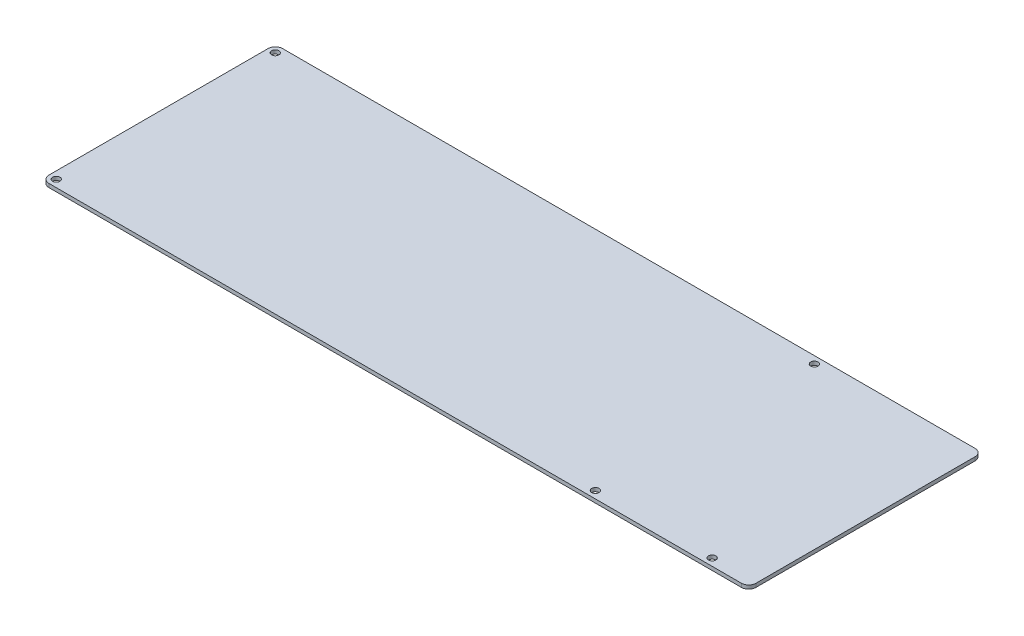
from build123d import *

# Parameters (mm, degrees)
SKETCH1_W           = 614.97
SKETCH1_H           = 203.2
SKETCH1_R           = 3.175
BOSS_EXTRUDE1_DEPTH = 3.175
FILLET1_R           = 6.35


with BuildPart() as part:
    # Sketch1 → Boss-Extrude1 (new body)
    with BuildSketch(Plane(origin=(0, 0, 0), x_dir=(1, 0, 0), z_dir=(0, 1, 0))):
        with Locations((-347.095055786, 167.356642248)):
            Rectangle(SKETCH1_W, SKETCH1_H)
        with Locations((-648.230055786, 72.106642248)):
            Circle(SKETCH1_R, mode=Mode.SUBTRACT)
        with Locations((-179.310055786, 72.106642248)):
            Circle(SKETCH1_R, mode=Mode.SUBTRACT)
        with Locations((-77.710055786, 72.106642248)):
            Circle(SKETCH1_R, mode=Mode.SUBTRACT)
        with Locations((-648.230055786, 262.606642248)):
            Circle(SKETCH1_R, mode=Mode.SUBTRACT)
        with Locations((-179.310055786, 262.606642248)):
            Circle(SKETCH1_R, mode=Mode.SUBTRACT)
    extrude(amount=-BOSS_EXTRUDE1_DEPTH)

    # Fillet1
    fillet1_edges = [part.edges().sort_by_distance(p)[0] for p in [
        (-39.610055786, -1.5875, -268.956642248),
        (-654.580055786, -1.5875, -268.956642248),
        (-39.610055786, -1.5875, -65.756642248),
        (-654.580055786, -1.5875, -65.756642248),
    ]]
    fillet(fillet1_edges, radius=FILLET1_R)


solid = part.part
